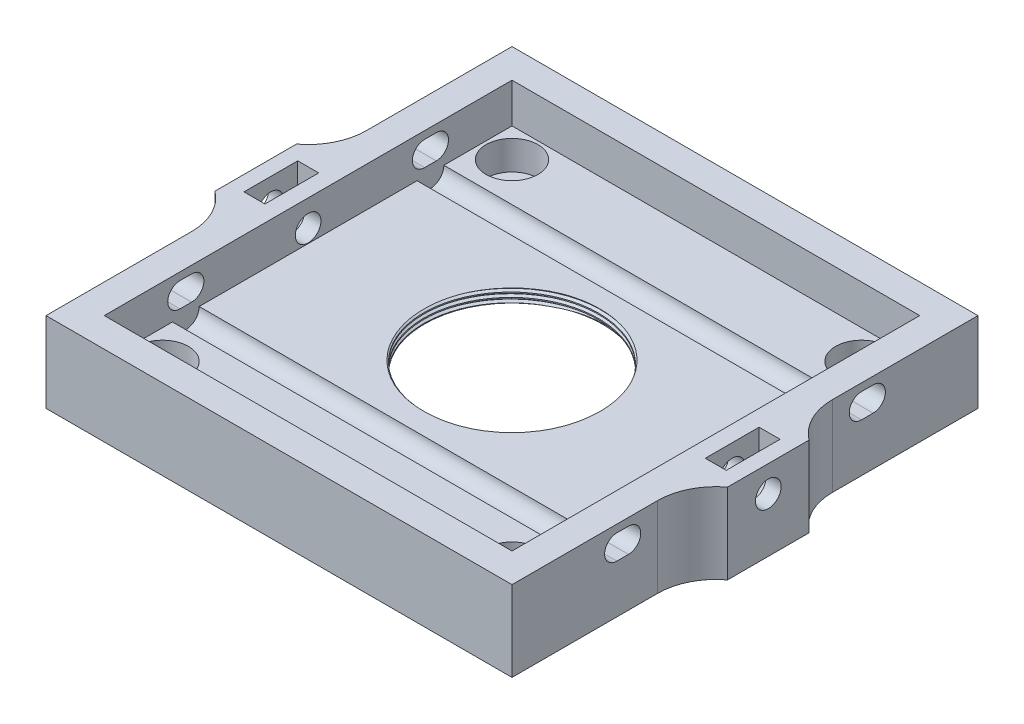
from build123d import *

# Parameters (mm, degrees)
SKETCH1_W                = 40
SKETCH1_H                = 40
BOSS_EXTRUDE1_DEPTH      = 3.5
SKETCH2_W                = 40
SKETCH2_H                = 40
SKETCH2_W_2              = 35
SKETCH2_H_2              = 35
BOSS_EXTRUDE2_DEPTH      = 3.4
SKETCH7_R                = 7.5
CUT_EXTRUDE5_DEPTH       = 29.5
SKETCH9_R                = 2.225
CUT_EXTRUDE6_DEPTH       = 2.5
SKETCH10_R               = 1.35
CUT_EXTRUDE7_DEPTH       = 29.5
SKETCH13_W               = 2
SKETCH13_H               = 7
BOSS_EXTRUDE3_DEPTH      = 6.9
CUT_EXTRUDE8_DEPTH       = 45.809150851
CUT_EXTRUDE8_DEPTH_BACK  = 45.809150851
FILLET1_R                = 5
CHAMFER1_SIZE            = 2.5
CHAMFER1_SIZE2           = 5.361267301
THREAD1_PITCH            = 0.4
CUT_EXTRUDE12_DEPTH      = 0.7
CUT_EXTRUDE12_DEPTH_BACK = 1.1
SKETCH25_W               = 1.1
SKETCH25_H               = 4.618802154
SKETCH25_W_2             = 0.7
SKETCH25_W_3             = 1.8
CUT_EXTRUDE13_DEPTH      = 2.25
CUT_EXTRUDE14_DEPTH      = 0.7
CUT_EXTRUDE14_DEPTH_BACK = 1.1
CUT_EXTRUDE15_DEPTH      = 47.048018416
CUT_EXTRUDE15_DEPTH_BACK = 47.048018416
SKETCH27_R               = 1.1
SKETCH28_R               = 1.15
CUT_EXTRUDE16_DEPTH      = 35


with BuildPart() as part:
    # Sketch1 → Boss-Extrude1 (new body)
    with BuildSketch(Plane(origin=(0, 0, 0), x_dir=(1, 0, 0), z_dir=(0, 1, 0))):
        Rectangle(SKETCH1_W, SKETCH1_H)
    extrude(amount=BOSS_EXTRUDE1_DEPTH)

    # Sketch2 → Boss-Extrude2 (add)
    with BuildSketch(Plane(origin=(0, 3.5, 0), x_dir=(1, 0, 0), z_dir=(0, 1, 0))):
        Rectangle(SKETCH2_W, SKETCH2_H)
        Rectangle(SKETCH2_W_2, SKETCH2_H_2, mode=Mode.SUBTRACT)
    extrude(amount=BOSS_EXTRUDE2_DEPTH)

    # Sketch7 → Cut-Extrude5 (cut, through all)
    with BuildSketch(Plane(origin=(0, 3.5, 0), x_dir=(1, 0, 0), z_dir=(0, 1, 0))):
        with Locations(Location((0, 0, 0), (0, 0, 270))):
            Circle(SKETCH7_R)
    extrude(amount=-CUT_EXTRUDE5_DEPTH, mode=Mode.SUBTRACT)

    # Sketch9 → Cut-Extrude6 (cut)
    with BuildSketch(Plane(origin=(0, 3.5, 0), x_dir=(1, 0, 0), z_dir=(0, 1, 0))):
        with Locations(Location((-15, 15, 0), (0, 0, 270))):
            Circle(SKETCH9_R)
        with Locations(Location((15, 15, 0), (0, 0, 270))):
            Circle(SKETCH9_R)
        with Locations(Location((-15, -15, 0), (0, 0, 270))):
            Circle(SKETCH9_R)
        with Locations(Location((15, -15, 0), (0, 0, 270))):
            Circle(SKETCH9_R)
    extrude(amount=-CUT_EXTRUDE6_DEPTH, mode=Mode.SUBTRACT)

    # Sketch10 → Cut-Extrude7 (cut, through all)
    with BuildSketch(Plane(origin=(0, 3.5, 0), x_dir=(1, 0, 0), z_dir=(0, 1, 0))):
        with Locations(Location((-15, 15, 0), (0, 0, 270))):
            Circle(SKETCH10_R)
        with Locations(Location((15, 15, 0), (0, 0, 270))):
            Circle(SKETCH10_R)
        with Locations(Location((15, -15, 0), (0, 0, 270))):
            Circle(SKETCH10_R)
        with Locations(Location((-15, -15, 0), (0, 0, 270))):
            Circle(SKETCH10_R)
    extrude(amount=-CUT_EXTRUDE7_DEPTH, mode=Mode.SUBTRACT)

    # Sketch13 → Boss-Extrude3 (add)
    with BuildSketch(Plane.XZ):
        with Locations((21, 0)):
            Rectangle(SKETCH13_W, SKETCH13_H)
        with Locations((-21, 0)):
            Rectangle(SKETCH13_W, SKETCH13_H)
    extrude(amount=-BOSS_EXTRUDE3_DEPTH)

    # Sketch11 → Cut-Extrude8 (cut, two sides: drawn at the far end of the back side and taken through both)
    with BuildSketch(Plane(origin=(-17.5, 0, 0), x_dir=(0, 0, -1), z_dir=(1, 0, 0)).offset(-CUT_EXTRUDE8_DEPTH_BACK)):
        with BuildLine():
            Line((-11, 6.25), (-10, 6.25))
            ThreePointArc((-10, 6.25), (-8.95, 5.2), (-10, 4.15))
            Line((-10, 4.15), (-11, 4.15))
            ThreePointArc((-11, 4.15), (-12.05, 5.2), (-11, 6.25))
        make_face()
        with BuildLine():
            Line((10, 6.25), (11, 6.25))
            ThreePointArc((11, 6.25), (12.05, 5.2), (11, 4.15))
            Line((11, 4.15), (10, 4.15))
            ThreePointArc((10, 4.15), (8.95, 5.2), (10, 6.25))
        make_face()
    extrude(amount=CUT_EXTRUDE8_DEPTH + CUT_EXTRUDE8_DEPTH_BACK, mode=Mode.SUBTRACT)

    # Fillet1
    # the kernel refuses this fillet: 5 mm, written as the material it adds along each edge
    with BuildSketch(Plane(origin=(-20, 0, 3.5), x_dir=(0, 0, 1), z_dir=(0, 1, 0))) as fillet1_piece_1:
        with BuildLine():
            CenterArc((4, -5), FILLET1_R, 90, 53.130102354)
            Line((0, -2), (-0.08, -1.94))
            ThreePointArc((-0.08, -1.94), (-0.1, -1), (-0.1, 0))
            Line((-0.1, 0), (0, 0.1))
            Line((0, 0.1), (4, 0.1))
            Line((4, 0.1), (4, 0))
        make_face()
    extrude(amount=6.9)
    with BuildSketch(Plane(origin=(-20, 0, -3.5), x_dir=(0, 0, -1), z_dir=(0, 1, 0)), Plane(origin=(20, 0, 3.5), x_dir=(0, 0, 1), z_dir=(0, 1, 0))) as fillet1_piece_2:
        with BuildLine():
            CenterArc((4, 5), FILLET1_R, 216.869897646, 53.130102354)
            Line((0, 2), (-0.08, 1.94))
            ThreePointArc((-0.08, 1.94), (-0.1, 1), (-0.1, 0))
            Line((-0.1, 0), (0, -0.1))
            Line((0, -0.1), (4, -0.1))
            Line((4, -0.1), (4, 0))
        make_face()
    extrude(amount=6.9)
    with BuildSketch(Plane(origin=(20, 0, -3.5), x_dir=(1, 0, 0), z_dir=(0, 1, 0))) as fillet1_piece_3:
        with BuildLine():
            CenterArc((5, 4), FILLET1_R, 180, 53.130102354)
            Line((0, 4), (-0.1, 4))
            Line((-0.1, 4), (-0.1, 0))
            Line((-0.1, 0), (0, -0.1))
            ThreePointArc((0, -0.1), (1, -0.1), (1.94, -0.08))
            Line((1.94, -0.08), (2, 0))
        make_face()
    extrude(amount=6.9)

    # Chamfer1
    chamfer1_edges = [part.edges().sort_by_distance(p)[0] for p in [
        (0, 0, -7.5),
    ]]
    chamfer1_side = [part.faces().sort_by_distance(p)[0] for p in [
        (0, 1.75, -7.5),
    ]]
    chamfer(chamfer1_edges, length=CHAMFER1_SIZE, length2=CHAMFER1_SIZE2, reference=chamfer1_side[0])

    # Sketch20 → Cut-Revolve3 (revolve, cut)
    with BuildSketch(Plane.XY, mode=Mode.PRIVATE) as cut_revolve3_sk:
        Polygon((-7.778913411, 2.368163994), (-7.461705686, 2.516080385), (-7.696628841, 2.601585421), (-7.781274508, 2.369023362), align=None)
        Polygon((-8.096121137, 2.220247602), (-7.782133877, 2.366662266), (-7.781274508, 2.369023362), (-8.013836566, 2.453669029), (-8.098482233, 2.221106971), align=None)
        Polygon((-8.413328862, 2.07233121), (-8.099341602, 2.218745874), (-8.098482233, 2.221106971), (-8.331044292, 2.305752638), (-8.415689959, 2.073190579), align=None)
        Polygon((-8.730536588, 1.924414819), (-8.416549328, 2.070829483), (-8.415689959, 2.073190579), (-8.648252017, 2.157836246), (-8.732897684, 1.925274188), align=None)
        Polygon((-9.047744313, 1.776498427), (-8.733757053, 1.922913091), (-8.732897684, 1.925274188), (-8.965459743, 2.009919855), (-9.05010541, 1.777357796), align=None)
        Polygon((-9.364952038, 1.628582035), (-9.050964779, 1.774996699), (-9.05010541, 1.777357796), (-9.282667468, 1.862003463), (-9.367313135, 1.629441404), align=None)
        Polygon((-9.682159764, 1.480665644), (-9.368172504, 1.627080308), (-9.367313135, 1.629441404), (-9.599875194, 1.714087071), (-9.684520861, 1.481525013), align=None)
        Polygon((-9.999367489, 1.332749252), (-9.68538023, 1.479163916), (-9.684520861, 1.481525013), (-9.917082919, 1.56617068), (-10.001728586, 1.333608621), align=None)
        Polygon((-10.316575215, 1.184832861), (-10.002587955, 1.331247524), (-10.001728586, 1.333608621), (-10.234290645, 1.418254288), (-10.318936312, 1.18569223), align=None)
        Polygon((-10.63378294, 1.036916469), (-10.31979568, 1.183331133), (-10.318936312, 1.18569223), (-10.55149837, 1.270337896), (-10.636144037, 1.037775838), align=None)
        Polygon((-10.950990666, 0.889000077), (-10.637003406, 1.035414741), (-10.636144037, 1.037775838), (-10.868706096, 1.122421505), (-10.953351762, 0.889859446), align=None)
        Polygon((-11.268198391, 0.741083686), (-10.954211131, 0.88749835), (-10.953351762, 0.889859446), (-11.185913821, 0.974505113), (-11.270559488, 0.741943055), align=None)
        Polygon((-11.585406117, 0.593167294), (-11.271418857, 0.739581958), (-11.270559488, 0.741943055), (-11.503121546, 0.826588722), (-11.587767213, 0.594026663), align=None)
        Polygon((-11.902613842, 0.445250903), (-11.588626582, 0.591665566), (-11.587767213, 0.594026663), (-11.820329272, 0.67867233), (-11.904974939, 0.446110271), align=None)
        Polygon((-12.219821568, 0.297334511), (-11.905834308, 0.443749175), (-11.904974939, 0.446110271), (-12.137536997, 0.530755938), (-12.222182664, 0.29819388), align=None)
        Polygon((-12.537029293, 0.149418119), (-12.223042033, 0.295832783), (-12.222182664, 0.29819388), (-12.454744723, 0.382839547), (-12.53939039, 0.150277488), align=None)
        Polygon((-12.857457484, 0), (-12.540249759, 0.147916392), (-12.53939039, 0.150277488), (-12.771952448, 0.234923155), align=None)
    revolve(cut_revolve3_sk.sketch.rotate(Axis((0, 0, 0), (0, 1, 0)), 90), axis=Axis((0, 0, 0), (0, 1, 0)), mode=Mode.SUBTRACT)

    # Thread1: the profile of Thread Profile2 profile screwed along a right-hand helix of 7.5 turns, 6 arcs to a turn; built about Z, then put on its axis
    thread1_z = Axis((0, 0, 0), (0, 0, 1))
    thread1_corners = [(7.4997, 0, -0.000173205), (7.71650635, 0, 0.124999999), (7.71650635, 0, 0.174999999), (7.4997, 0, 0.300173204)]
    with BuildLine(mode=Mode.PRIVATE) as thread1_profile:
        Line(thread1_corners[0], thread1_corners[1])
        Line(thread1_corners[1], thread1_corners[2])
        Line(thread1_corners[2], thread1_corners[3])
        Line(thread1_corners[3], thread1_corners[0])
    thread1_cap = Face(thread1_profile.wire())
    thread1_turn_angles = [0, 30, 60, 90, 120, 150, 180, 210, 240, 270, 300, 330, 360]
    thread1_turn_weights = [1, 0.8660254037844387, 1, 0.8660254037844387, 1, 0.8660254037844387, 1, 0.8660254037844387, 1, 0.8660254037844387, 1, 0.8660254037844387, 1]
    thread1_turn_rails = [Edge.make_bspline([Vector(p[0], p[1], 0).rotate(thread1_z, thread1_turn_angles[k]) / thread1_turn_weights[k] + Vector(0, 0, p[2] + THREAD1_PITCH * thread1_turn_angles[k] / 360) for k in range(13)], [0, 0, 0, 1, 1, 2, 2, 3, 3, 4, 4, 5, 5, 6, 6, 6], 2, thread1_turn_weights) for p in thread1_corners]
    thread1_turn_sides = [Face.make_surface_from_curves(thread1_turn_rails[p[0]], thread1_turn_rails[p[1]]) for p in [(0, 1), (1, 2), (2, 3), (3, 0)]]
    thread1_last_angles = [2520, 2550, 2580, 2610, 2640, 2670, 2700]
    thread1_last_weights = [1, 0.8660254037844387, 1, 0.8660254037844387, 1, 0.8660254037844387, 1]
    thread1_last_rails = [Edge.make_bspline([Vector(p[0], p[1], 0).rotate(thread1_z, thread1_last_angles[k]) / thread1_last_weights[k] + Vector(0, 0, p[2] + THREAD1_PITCH * thread1_last_angles[k] / 360) for k in range(7)], [0, 0, 0, 1, 1, 2, 2, 3, 3, 3], 2, thread1_last_weights) for p in thread1_corners]
    thread1_last_sides = [Face.make_surface_from_curves(thread1_last_rails[p[0]], thread1_last_rails[p[1]]) for p in [(0, 1), (1, 2), (2, 3), (3, 0)]]
    thread1 = Plane(origin=(0, 4.5, 0), x_dir=(-1, 0, 0), z_dir=(0, -1, 0)) * Solid(Shell([*[p.moved(Location((0, 0, THREAD1_PITCH * i))) for i in range(7) for p in thread1_turn_sides], *thread1_last_sides, thread1_cap, thread1_cap.rotate(thread1_z, 2700).moved(Location((0, 0, THREAD1_PITCH * 2700 / 360)))]))
    add(thread1, mode=Mode.SUBTRACT)

    # Sketch24 → Cut-Extrude12 (cut, two sides: drawn at the far end of the back side and taken through both)
    with BuildSketch(Plane.ZY.offset(20).offset(-CUT_EXTRUDE12_DEPTH_BACK)):
        Polygon((2.309401077, 4.65), (1.154700538, 6.65), (-1.154700538, 6.65), (-2.309401077, 4.65), (-1.154700538, 2.65), (1.154700538, 2.65), align=None)
    extrude(amount=CUT_EXTRUDE12_DEPTH + CUT_EXTRUDE12_DEPTH_BACK, mode=Mode.SUBTRACT)

    # Sketch25 → Cut-Extrude13 (cut)
    with BuildSketch(Plane(origin=(0, 6.9, 0), x_dir=(1, 0, 0), z_dir=(0, 1, 0))):
        with Locations((-19.45, 0)):
            Rectangle(SKETCH25_W, SKETCH25_H)
        with Locations((-20.35, 0)):
            Rectangle(SKETCH25_W_2, SKETCH25_H)
        with Locations((19.8, 0)):
            Rectangle(SKETCH25_W_3, SKETCH25_H)
    extrude(amount=-CUT_EXTRUDE13_DEPTH, mode=Mode.SUBTRACT)

    # Sketch26 → Cut-Extrude14 (cut, two sides: drawn at the far end of the back side and taken through both)
    with BuildSketch(Plane(origin=(20, 0, 0), x_dir=(0, 0, -1), z_dir=(1, 0, 0)).offset(-CUT_EXTRUDE14_DEPTH_BACK)):
        Polygon((2.309401077, 4.65), (1.154700538, 6.65), (-1.154700538, 6.65), (-2.309401077, 4.65), (-1.154700538, 2.65), (1.154700538, 2.65), align=None)
    extrude(amount=CUT_EXTRUDE14_DEPTH + CUT_EXTRUDE14_DEPTH_BACK, mode=Mode.SUBTRACT)

    # Sketch27 → Cut-Extrude15 (cut, two sides: drawn at the far end of the back side and taken through both)
    with BuildSketch(Plane(origin=(18.9, 0, 0), x_dir=(0, 0, -1), z_dir=(1, 0, 0)).offset(-CUT_EXTRUDE15_DEPTH_BACK)):
        with Locations((0, 4.65)):
            Circle(SKETCH27_R)
    extrude(amount=CUT_EXTRUDE15_DEPTH + CUT_EXTRUDE15_DEPTH_BACK, mode=Mode.SUBTRACT)

    # Sketch28 → Cut-Extrude16 (cut)
    with BuildSketch(Plane(origin=(-17.5, 0, 0), x_dir=(0, 0, -1), z_dir=(1, 0, 0))):
        with Locations((-10.5, 3.5)):
            Circle(SKETCH28_R)
        with Locations((10.5, 3.5)):
            Circle(SKETCH28_R)
    extrude(amount=CUT_EXTRUDE16_DEPTH, mode=Mode.SUBTRACT)


solid = part.part
